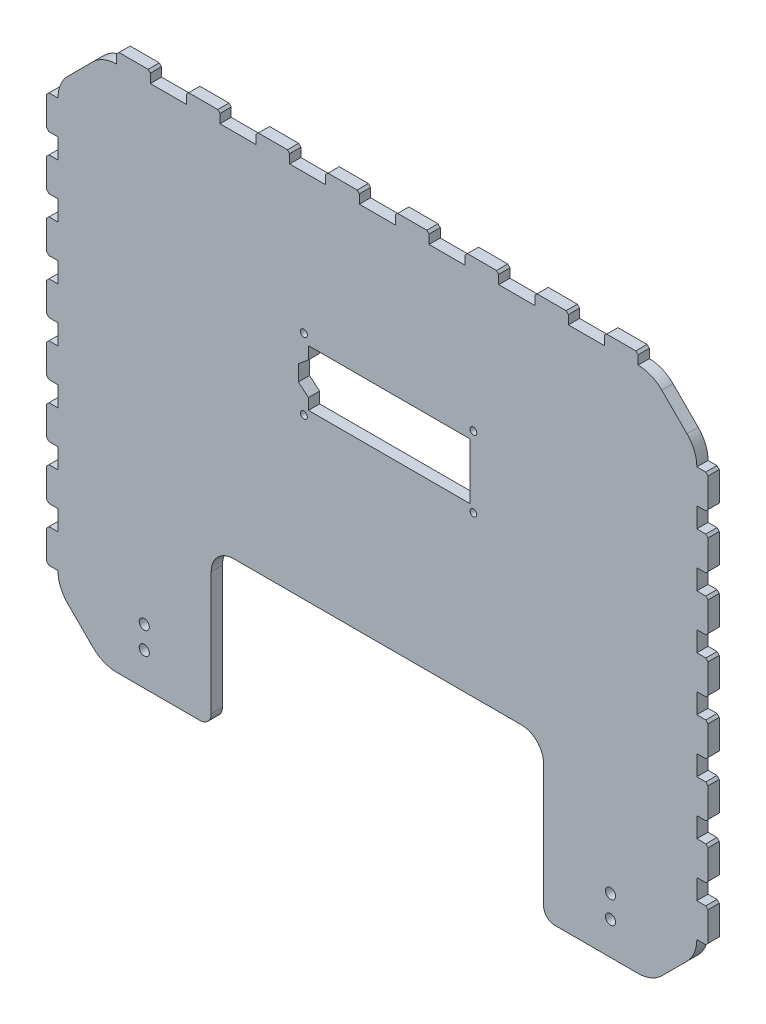
from build123d import *

# Parameters (mm, degrees)
ESQUISSE1_W                    = 285
ESQUISSE1_H                    = 235
BOSS_EXTRU_1_DEPTH             = 5
CHANFREIN1_SIZE                = 20
CONG_1_R                       = 15
ESQUISSE2_R                    = 1.55
ESQUISSE2_R_2                  = 1.5
ENL_V_MAT_EXTRU_1_DEPTH        = 5
ESQUISSE3_W                    = 72
ESQUISSE3_H                    = 25
ENL_V_MAT_EXTRU_2_DEPTH        = 370.425229241
ENL_V_MAT_EXTRU_3_DEPTH        = 370.425229241
ENL_V_MAT_EXTRU_4_DEPTH        = 370.425229241
CONG_2_R                       = 5
TENON_ET_MORTAISE_TENON1_DEPTH = 5
TENON_ET_MORTAISE_TENON3_DEPTH = 5
TENON_ET_MORTAISE_TENON4_DEPTH = 5
ESQUISSE6_R                    = 2.25
ENL_V_MAT_EXTRU_5_DEPTH        = 374.296129099


# Read off the part's stored shape, not the designer's step: Tenon et mortaise-Tenon1, Tenon et mortaise-Tenon3, Tenon et mortaise-Tenon4
with BuildPart() as part:
    # Esquisse1 → Boss.-Extru.1 (new body)
    with BuildSketch(Plane.XY):
        with Locations((-142.5, -117.5)):
            Rectangle(ESQUISSE1_W, ESQUISSE1_H)
    extrude(amount=BOSS_EXTRU_1_DEPTH)

    # Chanfrein1
    chanfrein1_edges = [part.edges().sort_by_distance(p)[0] for p in [
        (0, -235, 2.5),
        (-285, -235, 2.5),
        (-285, 0, 2.5),
        (0, 0, 2.5),
    ]]
    chamfer(chanfrein1_edges, length=CHANFREIN1_SIZE)

    # Congé1
    cong_1_edges = [part.edges().sort_by_distance(p)[0] for p in [
        (-20, -235, 2.5),
        (-265, -235, 2.5),
        (-285, -20, 2.5),
        (-285, -215, 2.5),
        (0, -20, 2.5),
        (0, -215, 2.5),
        (-265, 0, 2.5),
        (-20, 0, 2.5),
    ]]
    fillet(cong_1_edges, radius=CONG_1_R)

    # Esquisse2 → Enlèv. mat.-Extru.1 (cut)
    with BuildSketch(Plane.XY.offset(5)):
        with Locations((-175.3, -62.2)):
            Circle(ESQUISSE2_R)
        with Locations((-175.3, -93.8)):
            Circle(ESQUISSE2_R)
        with Locations((-99.7, -93.8)):
            Circle(ESQUISSE2_R_2)
        with Locations((-99.7, -62.2)):
            Circle(ESQUISSE2_R)
    extrude(amount=-ENL_V_MAT_EXTRU_1_DEPTH, mode=Mode.SUBTRACT)

    # Esquisse3 → Enlèv. mat.-Extru.2 (cut, through all)
    with BuildSketch(Plane(origin=(0, 0, 0), x_dir=(-1, 0, 0), z_dir=(0, 0, -1))):
        with Locations((137.25, -78.5)):
            Rectangle(ESQUISSE3_W, ESQUISSE3_H)
    extrude(amount=-ENL_V_MAT_EXTRU_2_DEPTH, mode=Mode.SUBTRACT)

    # Esquisse4 → Enlèv. mat.-Extru.3 (cut, through all)
    with BuildSketch(Plane.XY.offset(5)):
        Polygon((-173.25, -71.5), (-177.75, -75.27594834), (-177.75, -82.27594834), (-173.25, -86.051896681), align=None)
    extrude(amount=-ENL_V_MAT_EXTRU_3_DEPTH, mode=Mode.SUBTRACT)

    # Esquisse5 → Enlèv. mat.-Extru.4 (cut, through all)
    with BuildSketch(Plane(origin=(0, 0, 0), x_dir=(-1, 0, 0), z_dir=(0, 0, -1))):
        with BuildLine():
            Line((68.357864376, -235), (216.642135624, -235))
            Line((216.642135624, -235), (216.642135624, -175))
            ThreePointArc((216.642135624, -175), (213.713203436, -167.928932188), (206.642135624, -165))
            Line((206.642135624, -165), (78.357864376, -165))
            ThreePointArc((78.357864376, -165), (71.286796564, -167.928932188), (68.357864376, -175))
            Line((68.357864376, -175), (68.357864376, -235))
        make_face()
    extrude(amount=-ENL_V_MAT_EXTRU_4_DEPTH, mode=Mode.SUBTRACT)

    # Congé2
    cong_2_edges = [part.edges().sort_by_distance(p)[0] for p in [
        (-68.357864376, -235, 2.5),
        (-216.642135624, -235, 2.5),
    ]]
    fillet(cong_2_edges, radius=CONG_2_R)

    # Tenon et mortaise-Tenon1 outline → Tenon et mortaise-Tenon1 (add)
    with BuildSketch(Plane.XY):
        Polygon((-258.786796564, 0), (-243.786796564, 0), (-243.786796564, 4), (-244.786796564, 5), (-257.786796564, 5), (-258.786796564, 4), align=None)
        Polygon((-227.704854689, 0), (-212.704854689, 0), (-212.704854689, 4), (-213.704854689, 5), (-226.704854689, 5), (-227.704854689, 4), align=None)
        Polygon((-196.622912813, 0), (-181.622912813, 0), (-181.622912813, 4), (-182.622912813, 5), (-195.622912813, 5), (-196.622912813, 4), align=None)
        Polygon((-165.540970938, 0), (-150.540970938, 0), (-150.540970938, 4), (-151.540970938, 5), (-164.540970938, 5), (-165.540970938, 4), align=None)
        Polygon((-134.459029062, 0), (-119.459029062, 0), (-119.459029062, 4), (-120.459029062, 5), (-133.459029062, 5), (-134.459029062, 4), align=None)
        Polygon((-103.377087187, 0), (-88.377087187, 0), (-88.377087187, 4), (-89.377087187, 5), (-102.377087187, 5), (-103.377087187, 4), align=None)
        Polygon((-72.295145311, 0), (-57.295145311, 0), (-57.295145311, 4), (-58.295145311, 5), (-71.295145311, 5), (-72.295145311, 4), align=None)
        Polygon((-41.213203436, 4), (-41.213203436, 0), (-26.213203436, 0), (-26.213203436, 4), (-27.213203436, 5), (-40.213203436, 5), align=None)
    extrude(amount=TENON_ET_MORTAISE_TENON1_DEPTH)

    # Tenon et mortaise-Tenon3 outline → Tenon et mortaise-Tenon3 (add)
    with BuildSketch(Plane.XY):
        Polygon((4, -193.786796564), (0, -193.786796564), (0, -208.786796564), (4, -208.786796564), (5, -207.786796564), (5, -194.786796564), align=None)
        Polygon((4, -169.847711832), (0, -169.847711832), (0, -184.847711832), (4, -184.847711832), (5, -183.847711832), (5, -170.847711832), align=None)
        Polygon((4, -145.908627099), (0, -145.908627099), (0, -160.908627099), (4, -160.908627099), (5, -159.908627099), (5, -146.908627099), align=None)
        Polygon((4, -121.969542366), (0, -121.969542366), (0, -136.969542366), (4, -136.969542366), (5, -135.969542366), (5, -122.969542366), align=None)
        Polygon((4, -98.030457634), (0, -98.030457634), (0, -113.030457634), (4, -113.030457634), (5, -112.030457634), (5, -99.030457634), align=None)
        Polygon((4, -74.091372901), (0, -74.091372901), (0, -89.091372901), (4, -89.091372901), (5, -88.091372901), (5, -75.091372901), align=None)
        Polygon((4, -50.152288168), (0, -50.152288168), (0, -65.152288168), (4, -65.152288168), (5, -64.152288168), (5, -51.152288168), align=None)
        Polygon((5, -27.213203436), (4, -26.213203436), (0, -26.213203436), (0, -41.213203436), (4, -41.213203436), (5, -40.213203436), align=None)
    extrude(amount=TENON_ET_MORTAISE_TENON3_DEPTH)

    # Tenon et mortaise-Tenon4 outline → Tenon et mortaise-Tenon4 (add)
    with BuildSketch(Plane.XY):
        Polygon((-285, -208.786796564), (-285, -193.786796564), (-289, -193.786796564), (-290, -194.786796564), (-290, -207.786796564), (-289, -208.786796564), align=None)
        Polygon((-285, -184.847711832), (-285, -169.847711832), (-289, -169.847711832), (-290, -170.847711832), (-290, -183.847711832), (-289, -184.847711832), align=None)
        Polygon((-285, -160.908627099), (-285, -145.908627099), (-289, -145.908627099), (-290, -146.908627099), (-290, -159.908627099), (-289, -160.908627099), align=None)
        Polygon((-285, -136.969542366), (-285, -121.969542366), (-289, -121.969542366), (-290, -122.969542366), (-290, -135.969542366), (-289, -136.969542366), align=None)
        Polygon((-285, -113.030457634), (-285, -98.030457634), (-289, -98.030457634), (-290, -99.030457634), (-290, -112.030457634), (-289, -113.030457634), align=None)
        Polygon((-285, -89.091372901), (-285, -74.091372901), (-289, -74.091372901), (-290, -75.091372901), (-290, -88.091372901), (-289, -89.091372901), align=None)
        Polygon((-285, -65.152288168), (-285, -50.152288168), (-289, -50.152288168), (-290, -51.152288168), (-290, -64.152288168), (-289, -65.152288168), align=None)
        Polygon((-289, -26.213203436), (-290, -27.213203436), (-290, -40.213203436), (-289, -41.213203436), (-285, -41.213203436), (-285, -26.213203436), align=None)
    extrude(amount=TENON_ET_MORTAISE_TENON4_DEPTH)

    # Esquisse6 → Enlèv. mat.-Extru.5 (cut, through all)
    with BuildSketch(Plane.XY.offset(5)):
        with Locations((-38.5, -210.25)):
            Circle(ESQUISSE6_R)
        with Locations((-38.5, -220.25)):
            Circle(ESQUISSE6_R)
    enl_v_mat_extru_5 = extrude(amount=-ENL_V_MAT_EXTRU_5_DEPTH, mode=Mode.SUBTRACT)

    # Symétrie1: Enlèv. mat.-Extru.5 across plane
    add(enl_v_mat_extru_5.mirror(Plane(origin=(-142.5, 0, 0), x_dir=(0, 0, 1), z_dir=(1, 0, 0))), mode=Mode.SUBTRACT)


solid = part.part
